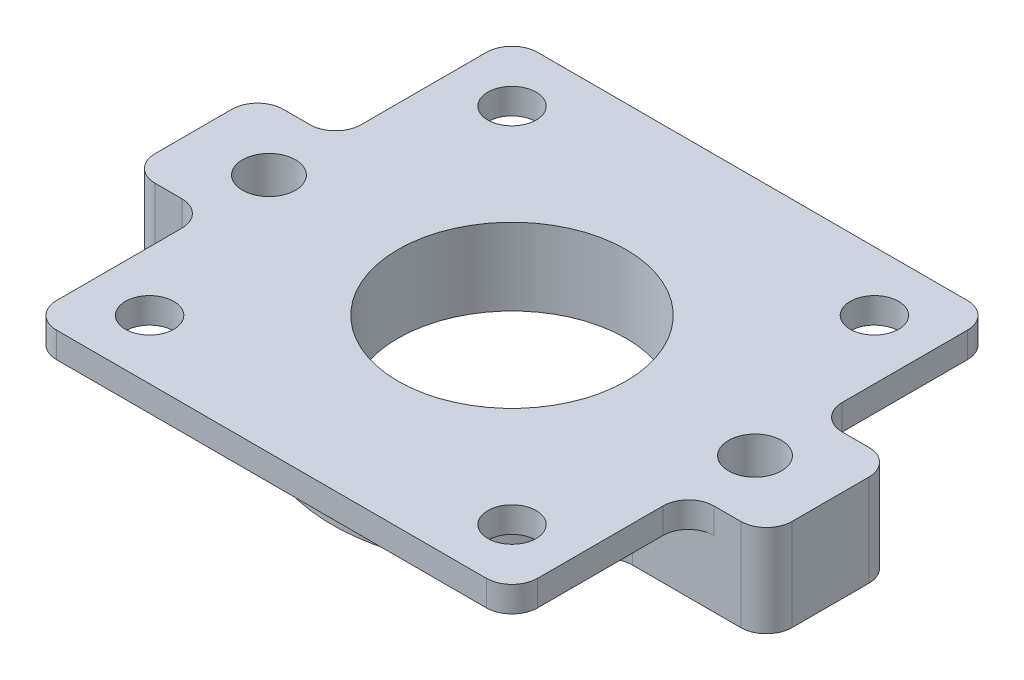
from build123d import *

# Parameters (mm, degrees)
SKETCH1_R                     = 13.843
SKETCH1_R_2                   = 11.303
BOSS_EXTRUDE1_DEPTH           = 7.62
BOSS_EXTRUDE4_DEPTH           = 1.5
BOSS_EXTRUDE4_DEPTH_BACK      = 7.62
SKETCH6_R                     = 17.78
SKETCH6_R_2                   = 16.51
BOSS_EXTRUDE5_DEPTH           = 9.12
BOSS_EXTRUDE6_START           = -2.54
BOSS_EXTRUDE6_OUTLINE_W       = 47.683186112
BOSS_EXTRUDE6_OUTLINE_H       = 47.683186112
BOSS_EXTRUDE6_OUTLINE_R       = 0.801080814
BOSS_EXTRUDE6_OUTLINE_R_2     = 13.843
BOSS_EXTRUDE6_DEPTH           = 2.54
SKETCH11_W                    = 2.4
SKETCH11_H                    = 2.54
M4_CLEARANCE_HOLE2_AT_2_COUNT = 2
M4_CLEARANCE_HOLE2_AT_2_PITCH = 35.921024484
M4_CLEARANCE_HOLE2_AT_3_COUNT = 2
M4_CLEARANCE_HOLE2_AT_3_PITCH = 50.8
M4_CLEARANCE_HOLE2_AT_4_COUNT = 2
M4_CLEARANCE_HOLE2_AT_4_PITCH = 35.921024484
FILLET1_R                     = 2.54
BOSS_EXTRUDE7_START           = 5.08
SKETCH12_R                    = 16.51
SKETCH12_R_2                  = 13.843
BOSS_EXTRUDE7_DEPTH           = 5.08
SKETCH8_R                     = 2.625
CUT_EXTRUDE2_DEPTH            = 41.597607221
FILLET2_R                     = 2.54


# Read off the part's stored shape, not the designer's step: Boss-Extrude6
with BuildPart() as part:
    # Sketch1 → Boss-Extrude1 (new body)
    with BuildSketch(Plane(origin=(0, 0, 0), x_dir=(1, 0, 0), z_dir=(0, 1, 0))):
        with Locations(Location((0, 0, 0), (0, 0, 90))):
            Circle(SKETCH1_R)
        with Locations(Location((0, 0, 0), (0, 0, 90))):
            Circle(SKETCH1_R_2, mode=Mode.SUBTRACT)
    extrude(amount=BOSS_EXTRUDE1_DEPTH)

    # Boss-Extrude6 outline → Boss-Extrude6 (add)
    with BuildSketch(Plane(origin=(0, 7.62, 0), x_dir=(1, 0, 0), z_dir=(0, 1, 0)).offset(BOSS_EXTRUDE6_START)):
        Rectangle(BOSS_EXTRUDE6_OUTLINE_W, BOSS_EXTRUDE6_OUTLINE_H)
        with Locations((-17.960512242, -17.960512242)):
            Circle(BOSS_EXTRUDE6_OUTLINE_R, mode=Mode.SUBTRACT)
        with Locations((17.960512242, -17.960512242)):
            Circle(BOSS_EXTRUDE6_OUTLINE_R, mode=Mode.SUBTRACT)
        with Locations((-17.960512242, 17.960512242)):
            Circle(BOSS_EXTRUDE6_OUTLINE_R, mode=Mode.SUBTRACT)
        Circle(BOSS_EXTRUDE6_OUTLINE_R_2, mode=Mode.SUBTRACT)
        with Locations((17.960512242, 17.960512242)):
            Circle(BOSS_EXTRUDE6_OUTLINE_R, mode=Mode.SUBTRACT)
    extrude(amount=BOSS_EXTRUDE6_DEPTH)

    # Sketch11 → M4 Clearance Hole2 (revolve, cut)
    with BuildSketch(Plane(origin=(17.960512242, 5.08, -17.960512242), x_dir=(0, 0, -1), z_dir=(1, 0, 0))):
        with Locations((1.2, 1.27)):
            Rectangle(SKETCH11_W, SKETCH11_H)
    m4_clearance_hole2 = revolve(axis=Axis((17.960512242, -1.27, -17.960512242), (0, 1, 0)), mode=Mode.SUBTRACT)

    # M4 Clearance Hole2 at 2: M4 Clearance Hole2 ×2
    with Locations(*[(-i * M4_CLEARANCE_HOLE2_AT_2_PITCH, 0, 0) for i in range(1, M4_CLEARANCE_HOLE2_AT_2_COUNT)]):
        add(m4_clearance_hole2, mode=Mode.SUBTRACT)

    # M4 Clearance Hole2 at 3: M4 Clearance Hole2 ×2
    with Locations(*[Vector(-0.7071067811865477, 0, 0.7071067811865475) * (i * M4_CLEARANCE_HOLE2_AT_3_PITCH) for i in range(1, M4_CLEARANCE_HOLE2_AT_3_COUNT)]):
        add(m4_clearance_hole2, mode=Mode.SUBTRACT)

    # M4 Clearance Hole2 at 4: M4 Clearance Hole2 ×2
    with Locations(*[(0, 0, i * M4_CLEARANCE_HOLE2_AT_4_PITCH) for i in range(1, M4_CLEARANCE_HOLE2_AT_4_COUNT)]):
        add(m4_clearance_hole2, mode=Mode.SUBTRACT)

    # Fillet1
    fillet1_edges = [part.edges().sort_by_distance(p)[0] for p in [
        (23.841593056, 6.35, -23.841593056),
        (23.841593056, 6.35, 23.841593056),
        (-23.841593056, 6.35, 23.841593056),
        (-23.841593056, 6.35, -23.841593056),
    ]]
    fillet(fillet1_edges, radius=FILLET1_R)



with BuildPart() as body_2:
    # Sketch6 → Boss-Extrude4 (new, two sides: drawn at the far end of the back side and taken through both)
    with BuildSketch(Plane.XZ.offset(-BOSS_EXTRUDE4_DEPTH_BACK)):
        with Locations(Location((0, 0, 0), (0, 0, 90))):
            Circle(SKETCH6_R)
        with Locations(Location((0, 0, 0), (0, 0, 90))):
            Circle(SKETCH6_R_2, mode=Mode.SUBTRACT)
    extrude(amount=BOSS_EXTRUDE4_DEPTH + BOSS_EXTRUDE4_DEPTH_BACK)

    # Sketch7 → Boss-Extrude5 (add)
    with BuildSketch(Plane.XZ.offset(1.5)):
        Polygon((-18.868493037, 6.35), (-31.568493037, 6.35), (-31.568493037, -6.35), (-18.868493037, -6.35), (-16.578258023, -6.35), (-16.578258023, 6.35), align=None)
        Polygon((18.868493037, 6.35), (16.578258023, 6.35), (16.578258023, -6.35), (18.868493037, -6.35), (31.568493037, -6.35), (31.568493037, 6.35), align=None)
    extrude(amount=-BOSS_EXTRUDE5_DEPTH)


with BuildPart() as part_1:
    add(part.part)

    add(body_2.part)  # Boss-Extrude7 merges body 2
    # Sketch12 → Boss-Extrude7 (add)
    with BuildSketch(Plane.XZ.offset(-5.08).offset(BOSS_EXTRUDE7_START)):
        with Locations(Location((0, 0, 0), (0, 0, 90))):
            Circle(SKETCH12_R)
        Circle(SKETCH12_R_2, mode=Mode.SUBTRACT)
    extrude(amount=-BOSS_EXTRUDE7_DEPTH)

    # Sketch8 → Cut-Extrude2 (cut, through all)
    with BuildSketch(Plane.XZ.offset(1.5)):
        with Locations(Location((-24.087949006, 0, 0), (0, 0, 270))):
            Circle(SKETCH8_R)
        with Locations(Location((24.087949006, 0, 0), (0, 0, 90))):
            Circle(SKETCH8_R)
    extrude(amount=-CUT_EXTRUDE2_DEPTH, mode=Mode.SUBTRACT)

    # Fillet2
    fillet2_edges = [part_1.edges().sort_by_distance(p)[0] for p in [
        (-31.568493037, 3.06, 6.35),
        (-31.568493037, 3.06, -6.35),
        (-16.607404975, 1.79, -6.35),
        (31.568493037, 3.06, -6.35),
        (16.607404975, 1.79, 6.35),
        (31.568493037, 3.06, 6.35),
        (16.607404975, 1.79, -6.35),
        (23.841593056, 6.35, -6.35),
        (-23.841593056, 6.35, -6.35),
        (-16.607404975, 1.79, 6.35),
        (-23.841593056, 6.35, 6.35),
        (23.841593056, 6.35, 6.35),
    ]]
    fillet(fillet2_edges, radius=FILLET2_R)


solid = part_1.part
